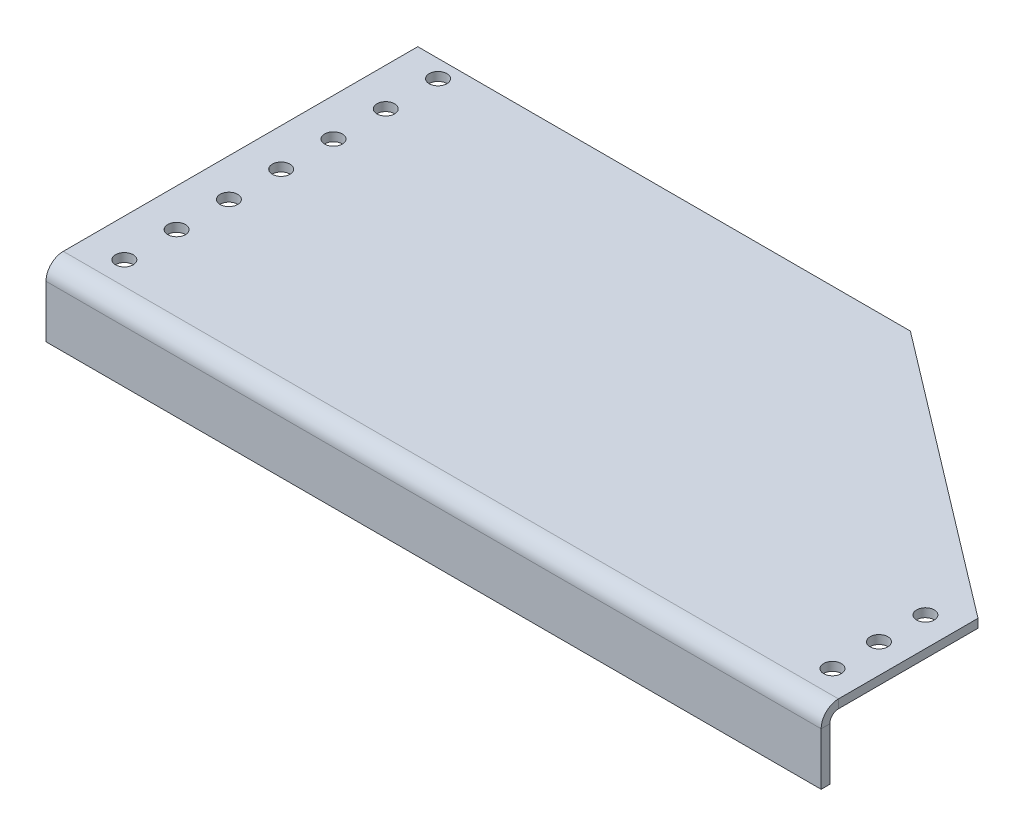
from build123d import *

# Parameters (mm, degrees)
SKETCH1_W                    = 211.836
SKETCH1_H                    = 175.514
BASE_FLANGE1_DEPTH           = 2.3622
EDGE_FLANGE4_STRIP_W         = 14.1688
EDGE_FLANGE4_STRIP_H         = 2.3622
EDGE_FLANGE4_STRIP_CUT_DEPTH = 211.836
EDGE_FLANGE4_DEPTH           = 211.836
CUT_EXTRUDE1_DEPTH           = 141.066325723
SKETCH38_R                   = 2.413
CUT_EXTRUDE3_DEPTH           = 141.066325723
SKETCH40_R                   = 2.413
CUT_EXTRUDE4_DEPTH           = 141.066325723


# Sheet-metal steps are written as plain solids
with BuildPart() as part:
    # Sketch1 → Base-Flange1 (new body)
    with BuildSketch(Plane(origin=(0, 0, 0), x_dir=(1, 0, 0), z_dir=(0, 1, 0))):
        Rectangle(SKETCH1_W, SKETCH1_H)
    extrude(amount=-BASE_FLANGE1_DEPTH)

    # Edge-Flange4 strip (across the edge) → Edge-Flange4 strip cut (cut)
    with BuildSketch(Plane(origin=(105.918, -2.3622, 87.757), x_dir=(0, 0, -1), z_dir=(-1, 0, 0))):
        with Locations((-4.7244, -1.1811)):
            Rectangle(EDGE_FLANGE4_STRIP_W, EDGE_FLANGE4_STRIP_H)
    extrude(amount=EDGE_FLANGE4_STRIP_CUT_DEPTH, mode=Mode.SUBTRACT)

    # Edge-Flange4 section (across the edge) → Edge-Flange4 (add)
    with BuildSketch(Plane(origin=(105.918, -2.3622, 87.757), x_dir=(0, 0, -1), z_dir=(-1, 0, 0))):
        with BuildLine():
            Line((-2.3622, 2.36), (-2.3622, 16.6878))
            Line((-2.3622, 16.6878), (0, 16.6878))
            Line((0, 16.6878), (0, 2.36))
            ThreePointArc((0, 2.36), (0.691227996, 0.691227996), (2.36, 0))
            Line((2.36, 0), (2.36, -2.3622))
            ThreePointArc((2.36, -2.3622), (-0.979099642, -0.979099642), (-2.3622, 2.36))
        make_face()
    extrude(amount=EDGE_FLANGE4_DEPTH)

    # Sketch36 → Cut-Extrude1 (cut, through all)
    with BuildSketch(Plane.XZ.offset(2.3622)):
        Polygon((28.702, -11.4808), (-105.918, -11.4808), (-105.918, -87.757), (105.918, -87.757), (105.918, 47.2567), align=None)
    extrude(amount=-CUT_EXTRUDE1_DEPTH, mode=Mode.SUBTRACT)

    # Sketch38 → Cut-Extrude3 (cut, through all)
    with BuildSketch(Plane.XZ.offset(2.3622)):
        with Locations(Location((97.9402, 79.047, 0), (0, 0, 270))):
            Circle(SKETCH38_R)
        with Locations(Location((97.9402, 66.347, 0), (0, 0, 270))):
            Circle(SKETCH38_R)
        with Locations(Location((97.9402, 53.647, 0), (0, 0, 270))):
            Circle(SKETCH38_R)
    extrude(amount=-CUT_EXTRUDE3_DEPTH, mode=Mode.SUBTRACT)

    # Sketch40 → Cut-Extrude4 (cut, through all)
    with BuildSketch(Plane.XZ.offset(2.3622)):
        with Locations(Location((-95.5802, 79.047, 0), (0, 0, 270))):
            Circle(SKETCH40_R)
        with Locations(Location((-95.5802, 64.7595, 0), (0, 0, 270))):
            Circle(SKETCH40_R)
        with Locations(Location((-95.5802, 50.472, 0), (0, 0, 270))):
            Circle(SKETCH40_R)
        with Locations(Location((-95.5802, 36.1845, 0), (0, 0, 270))):
            Circle(SKETCH40_R)
        with Locations(Location((-95.5802, 21.897, 0), (0, 0, 270))):
            Circle(SKETCH40_R)
        with Locations(Location((-95.5802, 7.6095, 0), (0, 0, 270))):
            Circle(SKETCH40_R)
        with Locations(Location((-95.5802, -6.678, 0), (0, 0, 270))):
            Circle(SKETCH40_R)
    extrude(amount=-CUT_EXTRUDE4_DEPTH, mode=Mode.SUBTRACT)


solid = part.part
